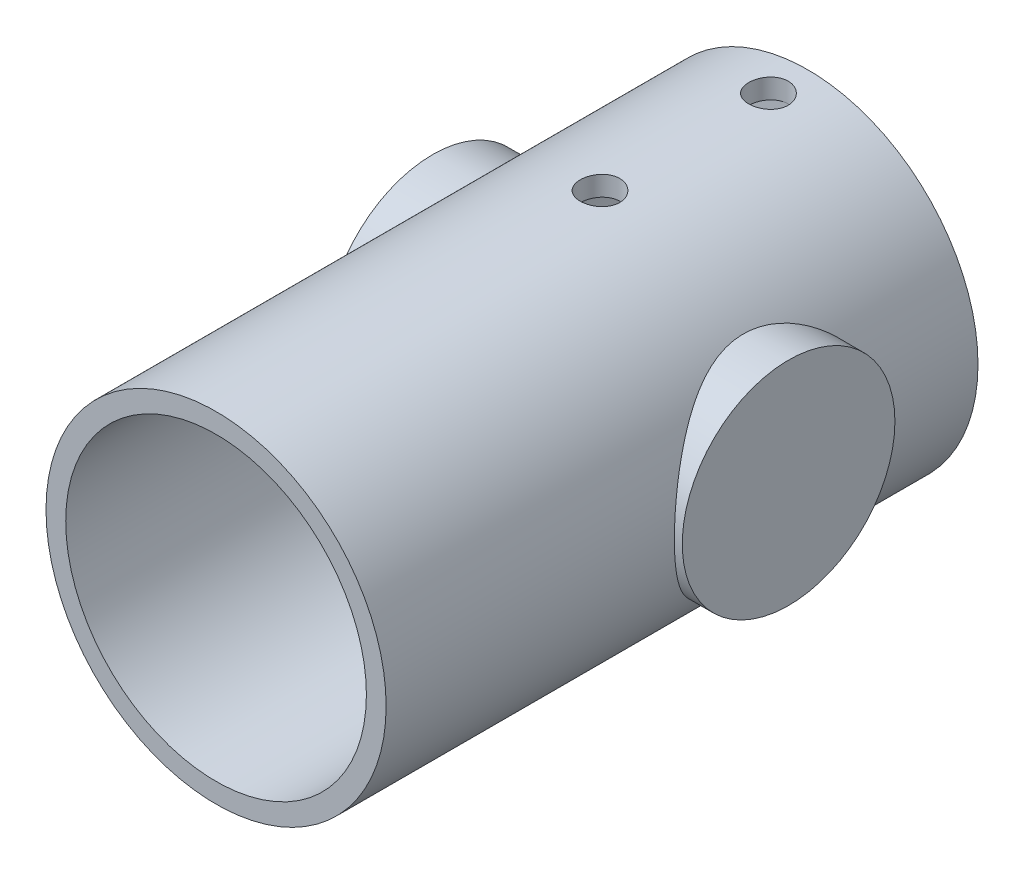
from build123d import *

# Parameters (mm, degrees)
SKETCH1_R           = 43.1
BOSS_EXTRUDE1_DEPTH = 150
SKETCH6_R           = 5
CUT_EXTRUDE3_DEPTH  = 179.292035717
SKETCH8_R           = 26.95
BOSS_EXTRUDE2_DEPTH = 20
SKETCH5_R           = 31.75
CUT_EXTRUDE4_DEPTH  = 163.454978525
SKETCH2_R           = 38.1
CUT_EXTRUDE5_DEPTH  = 145


with BuildPart() as part:
    # Sketch1 → Boss-Extrude1 (new body)
    with BuildSketch(Plane.XY):
        Circle(SKETCH1_R)
    extrude(amount=BOSS_EXTRUDE1_DEPTH)

    # Sketch6 → Cut-Extrude3 (cut, through all)
    with BuildSketch(Plane(origin=(0, 43.1, 0), x_dir=(1, 0, 0), z_dir=(0, 1, 0))):
        with Locations((0, -10)):
            Circle(SKETCH6_R)
        with Locations((0, -52.7)):
            Circle(SKETCH6_R)
    extrude(amount=-CUT_EXTRUDE3_DEPTH, mode=Mode.SUBTRACT)

    # Sketch8 → Boss-Extrude2 (add)
    with BuildSketch(Plane(origin=(45.1, 0, 0), x_dir=(0, 0, -1), z_dir=(1, 0, 0))):
        with Locations((-50, 0)):
            Circle(SKETCH8_R)
    boss_extrude2 = extrude(amount=-BOSS_EXTRUDE2_DEPTH)

    # Mirror1: Boss-Extrude2 across plane
    add(boss_extrude2.mirror(Plane(origin=(0, 0, 0), x_dir=(0, 0, 1), z_dir=(1, 0, 0))))

    # Sketch5 → Cut-Extrude4 (cut, through all)
    with BuildSketch(Plane.XY.offset(150)):
        Circle(SKETCH5_R)
    extrude(amount=-CUT_EXTRUDE4_DEPTH, mode=Mode.SUBTRACT)

    # Sketch2 → Cut-Extrude5 (cut)
    with BuildSketch(Plane.XY.offset(150)):
        Circle(SKETCH2_R)
    extrude(amount=-CUT_EXTRUDE5_DEPTH, mode=Mode.SUBTRACT)


solid = part.part
